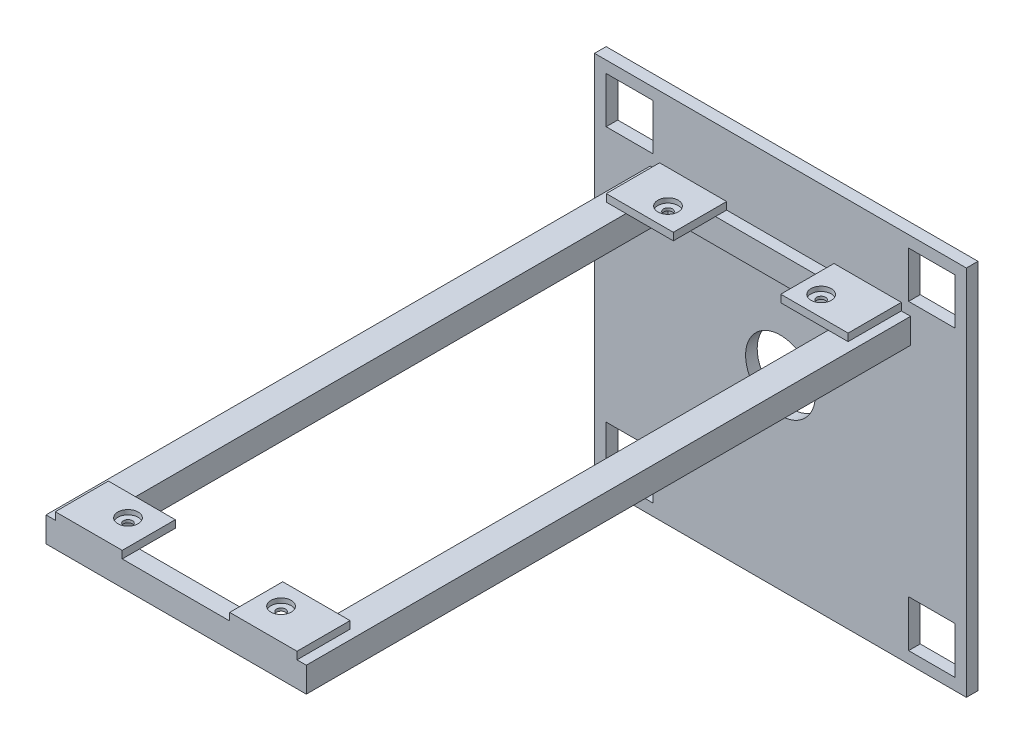
from build123d import *

# Parameters (mm, degrees)
SKETCH1_W                                           = 101.6
SKETCH1_H                                           = 101.6
BOSS_EXTRUDE1_DEPTH                                 = 3.175
SKETCH19_W                                          = 12.75921203
SKETCH19_H                                          = 12.60998148
SKETCH19_W_2                                        = 12.60998148
SKETCH19_H_2                                        = 12.75921203
CUT_EXTRUDE1_DEPTH                                  = 3.175
F_3_4_0_75_DIAMETER_HOLE1_D                         = 19.05
SKETCH29_W                                          = 71.12
SKETCH29_H                                          = 6.858
BOSS_EXTRUDE11_DEPTH                                = 3.048
SKETCH30_W                                          = 7.950155684
SKETCH30_H                                          = 6.858
SKETCH30_W_2                                        = 7.931445158
BOSS_EXTRUDE12_DEPTH                                = 162.052
SKETCH31_W                                          = 4.703535719
SKETCH31_H                                          = 6.858
BOSS_EXTRUDE13_DEPTH                                = 55.88
SKETCH32_W                                          = 18.396349522
SKETCH32_H                                          = 14.499163276
SKETCH32_W_2                                        = 18.288
SKETCH32_H_2                                        = 14.533831847
SKETCH32_W_3                                        = 18.317097516
SKETCH32_H_3                                        = 14.559025954
BOSS_EXTRUDE14_DEPTH                                = 2.032
CBORE_FOR_2_BINDING_HEAD_MACHINE_SCREW1_D           = 2.4384
CBORE_FOR_2_BINDING_HEAD_MACHINE_SCREW1_CBORE_D     = 5.55752
CBORE_FOR_2_BINDING_HEAD_MACHINE_SCREW1_CBORE_DEPTH = 1.27


with BuildPart() as part:
    # Sketch1 → Boss-Extrude1 (new body)
    with BuildSketch(Plane.XY):
        with Locations((52.482861157, 13.097719286)):
            Rectangle(SKETCH1_W, SKETCH1_H)
    extrude(amount=BOSS_EXTRUDE1_DEPTH)

    # Sketch19 → Cut-Extrude1 (cut)
    with BuildSketch(Plane.XY.offset(3.175)):
        with Locations((11.237467172, 54.417728546)):
            Rectangle(SKETCH19_W, SKETCH19_H)
        with Locations((93.802870417, -28.147674699)):
            Rectangle(SKETCH19_W_2, SKETCH19_H_2)
        with Locations((93.802870417, 54.417728546)):
            Rectangle(SKETCH19_W_2, SKETCH19_H)
        with Locations((11.237467172, -28.147674699)):
            Rectangle(SKETCH19_W, SKETCH19_H_2)
    extrude(amount=-CUT_EXTRUDE1_DEPTH, mode=Mode.SUBTRACT)

    # 3/4 (0.75) Diameter Hole1 (through all)
    with Locations(Plane(origin=(0, 0, 0), x_dir=(-1, 0, 0), z_dir=(0, 0, -1))):
        with Locations((-52.482861157, 13.097719286)):
            Hole(F_3_4_0_75_DIAMETER_HOLE1_D / 2)

    # Sketch29 → Boss-Extrude11 (add)
    with BuildSketch(Plane.XY.offset(3.175)):
        with Locations((52.482988157, 41.418719286)):
            Rectangle(SKETCH29_W, SKETCH29_H)
    extrude(amount=BOSS_EXTRUDE11_DEPTH)

    # Sketch30 → Boss-Extrude12 (add)
    with BuildSketch(Plane.XY.offset(6.223)):
        with Locations((84.067910315, 41.418719286)):
            Rectangle(SKETCH30_W, SKETCH30_H)
        with Locations((20.888710736, 41.418719286)):
            Rectangle(SKETCH30_W_2, SKETCH30_H)
    extrude(amount=BOSS_EXTRUDE12_DEPTH)

    # Sketch31 → Boss-Extrude13 (add)
    with BuildSketch(Plane.ZY.offset(-80.092832473)):
        with Locations((165.923232141, 41.418719286)):
            Rectangle(SKETCH31_W, SKETCH31_H)
    extrude(amount=BOSS_EXTRUDE13_DEPTH)

    # Sketch32 → Boss-Extrude14 (add)
    with BuildSketch(Plane(origin=(0, 44.847719286, 0), x_dir=(1, 0, 0), z_dir=(0, 1, 0))):
        with Locations((76.304813396, -161.025418362)):
            Rectangle(SKETCH32_W, SKETCH32_H)
        with Locations((28.606988157, -161.025418362)):
            Rectangle(SKETCH32_W_2, SKETCH32_H)
        with Locations((76.304813396, -10.441915924)):
            Rectangle(SKETCH32_W, SKETCH32_H_2)
        with Locations((28.621536915, -10.454512977)):
            Rectangle(SKETCH32_W_3, SKETCH32_H_3)
    extrude(amount=BOSS_EXTRUDE14_DEPTH)

    # CBORE for #2 Binding Head Machine Screw1 (through all)
    with Locations(Plane(origin=(0, 46.879719286, 0), x_dir=(1, 0, 0), z_dir=(0, 1, 0))):
        with Locations((30.849059254, -12.257454761), (72.6744096, -12.257454761), (72.6744096, -159.799983742), (30.849059254, -159.799983742)):
            CounterBoreHole(CBORE_FOR_2_BINDING_HEAD_MACHINE_SCREW1_D / 2, CBORE_FOR_2_BINDING_HEAD_MACHINE_SCREW1_CBORE_D / 2, CBORE_FOR_2_BINDING_HEAD_MACHINE_SCREW1_CBORE_DEPTH)


solid = part.part
